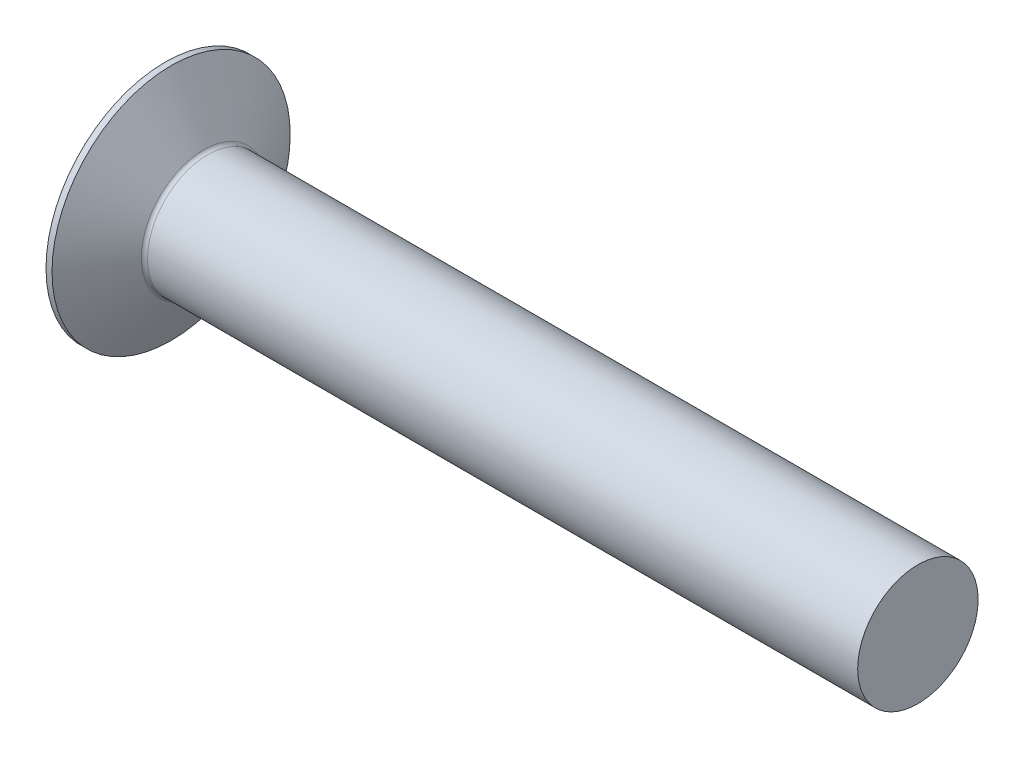
from build123d import *


with BuildPart() as part:
    # Sketch1 → Base-Revolve (revolve)
    with BuildSketch(Plane.XY):
        with BuildLine():
            Line((50, 0), (50, 4))
            Line((50, 4), (2.830644633, 4))
            ThreePointArc((2.830644633, 4), (2.680644633, 4.040192379), (2.570837012, 4.15))
            Line((2.570837012, 4.15), (0.4, 7.91))
            Line((0.4, 7.91), (0, 7.91))
            Line((0, 7.91), (0, 0))
            Line((0, 0), (50, 0))
        make_face()
    revolve(axis=Axis((-69.069553073, 0, 0), (1, 0, 0)))


solid = part.part
